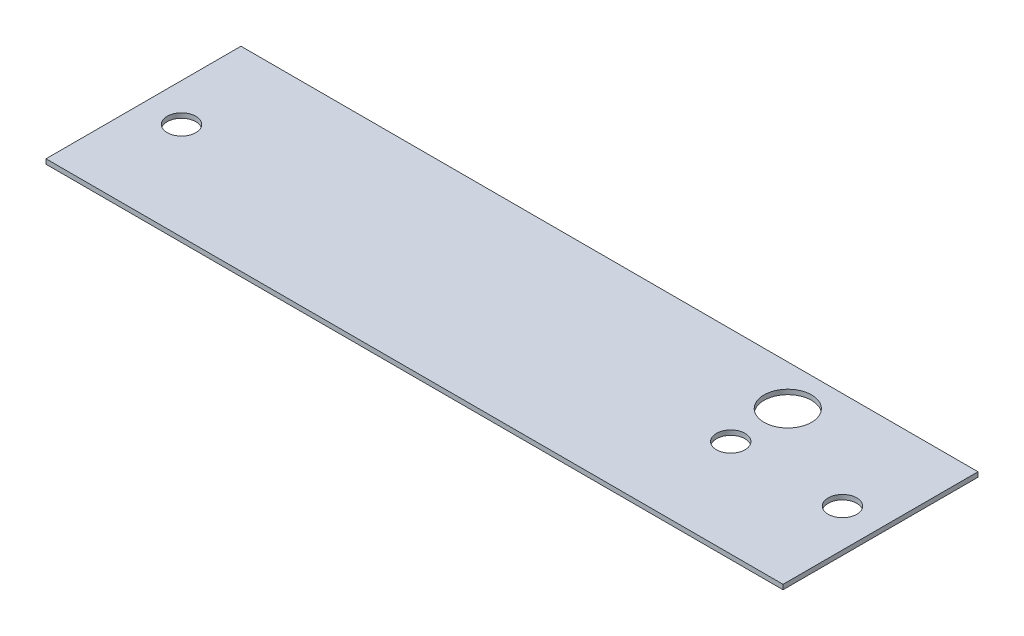
from build123d import *

# Parameters (mm, degrees)
CROQUIS1_W            = 77.5
CROQUIS1_H            = 20.5
CROQUIS1_R            = 1.5
BRIDA_BASE1_DEPTH     = 0.5
CROQUIS2_R            = 1.5
CROQUIS2_R_2          = 2.5
CORTAR_EXTRUIR1_DEPTH = 10


# Sheet-metal steps are written as plain solids
with BuildPart() as part:
    # Croquis1 → Brida base1 (new body)
    with BuildSketch(Plane(origin=(0, 0, 0), x_dir=(1, 0, 0), z_dir=(0, 1, 0))):
        with Locations((-15.796159052, -24.916988156)):
            Rectangle(CROQUIS1_W, CROQUIS1_H)
        with Locations(Location((-50.546159052, -24.916988156, 0), (0, 0, 270))):
            Circle(CROQUIS1_R, mode=Mode.SUBTRACT)
        with Locations(Location((18.953840948, -24.916988156, 0), (0, 0, 90))):
            Circle(CROQUIS1_R, mode=Mode.SUBTRACT)
    extrude(amount=-BRIDA_BASE1_DEPTH)

    # Croquis2 → Cortar-Extruir1 (cut)
    with BuildSketch(Plane(origin=(0, 0, 0), x_dir=(-1, 0, 0), z_dir=(0, 1, 0))):
        with Locations(Location((-7.203840948, 24.916988156, 0), (0, 0, 90))):
            Circle(CROQUIS2_R)
        with Locations(Location((-7.203840948, 18.916988156, 0), (0, 0, 90))):
            Circle(CROQUIS2_R_2)
    extrude(amount=-CORTAR_EXTRUIR1_DEPTH, mode=Mode.SUBTRACT)


solid = part.part
